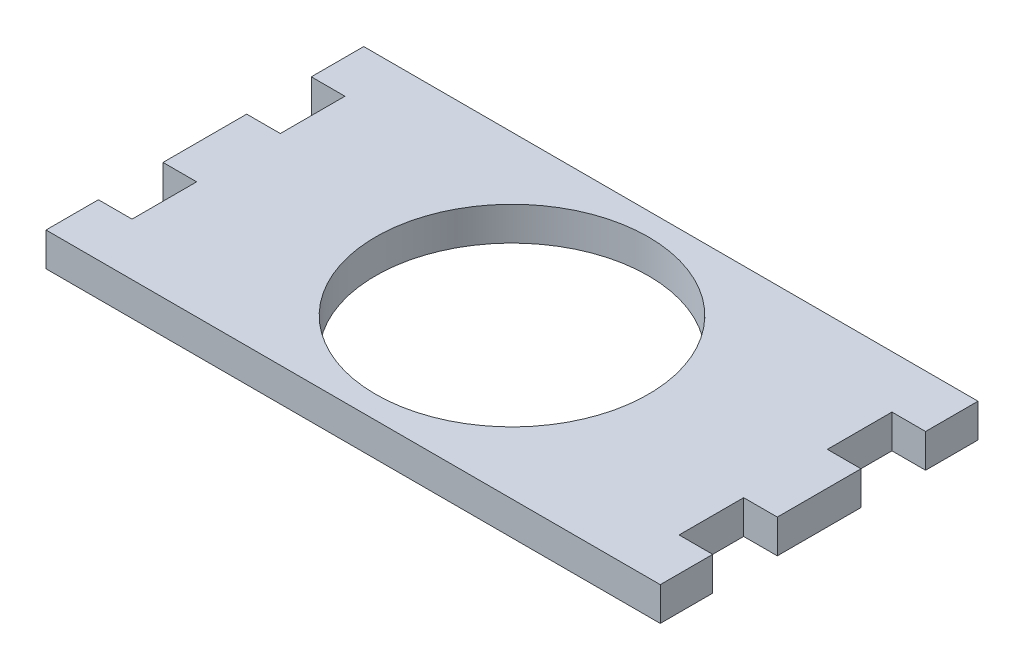
from build123d import *

# Parameters (mm, degrees)
SKETCH1_R           = 12.875
BOSS_EXTRUDE1_DEPTH = 3.175


with BuildPart() as part:
    # Sketch1 → Boss-Extrude1 (new body)
    with BuildSketch(Plane(origin=(0, 0, 0), x_dir=(1, 0, 0), z_dir=(0, 1, 0))):
        Polygon((-29, 15), (29, 15), (29, 10.05), (25.825, 10.05), (25.825, 3.95), (29, 3.95), (29, -3.95), (25.825, -3.95), (25.825, -10.05), (29, -10.05), (29, -15), (-29, -15), (-29, -10.05), (-25.825, -10.05), (-25.825, -3.95), (-29, -3.95), (-29, 3.95), (-25.825, 3.95), (-25.825, 10.05), (-29, 10.05), align=None)
        Circle(SKETCH1_R, mode=Mode.SUBTRACT)
    extrude(amount=BOSS_EXTRUDE1_DEPTH)


solid = part.part
